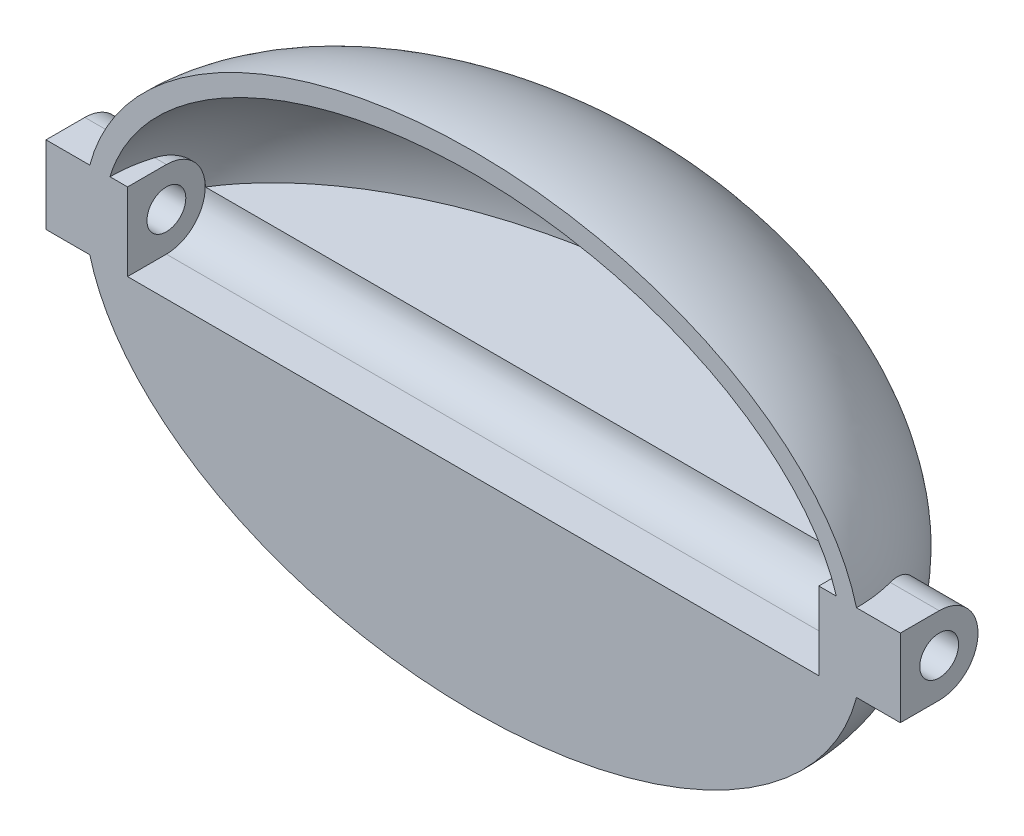
from build123d import *
from build123d.topology import SkipClean

# Parameters (mm, degrees)
SKETCH_3_W          = 40
SKETCH_3_H          = 40
CUT_EXTRUDE_1_DEPTH = 70
CUT_REVOLVE_1_ANGLE = 90
CUT_EXTRUDE_2_DEPTH = 456.68629575
EXTRUDE_1_DEPTH     = 42
SKETCH_7_R          = 10
CUT_EXTRUDE_3_DEPTH = 440


with BuildPart() as part:
    # 草图1 → 旋转3 (revolve)
    with SkipClean():  # the faces are left unmerged after this step: merging them gives an invalid solid
        with BuildSketch(Plane(origin=(0, 0, 0), x_dir=(1, 0, 0), z_dir=(0, 1, 0))):
            with BuildLine():
                add(Edge.make_bspline(
                    [(200, 0), (200, 125), (0, 125), (-200, 125), (-200, 0)],
                    knots=[0, 0, 0, 1.570796327, 1.570796327, 3.141592654, 3.141592654, 3.141592654], degree=2, weights=[1, 0.707106781, 1, 0.707106781, 1]))
                Line((-200, 0), (200, 0))
            make_face()
            with BuildLine():
                Line((200, 0), (-200, 0))
                add(Edge.make_bspline(
                    [(-200, 0), (-200, -125), (0, -125), (200, -125), (200, 0)],
                    knots=[3.141592654, 3.141592654, 3.141592654, 4.71238898, 4.71238898, 6.283185307, 6.283185307, 6.283185307], degree=2, weights=[1, 0.707106781, 1, 0.707106781, 1]))
            make_face()
        revolve(axis=Axis((-376.776806715, 0, 0), (1, 0, 0)))
    add(part.part.scale(1), mode=Mode.REPLACE)  # the faces are merged on a copy

    # Surface Cut 1
    split(bisect_by=Plane.XY, keep=Keep.BOTTOM)

    # 草图3 → 切除-拉伸1 (cut)
    with BuildSketch(Plane(origin=(0, -125.246294878, -45.585923288), x_dir=(1, 0, 0), z_dir=(0, 0.9396926207859081, 0.34202014332566943))):
        with Locations((0, 43.622733675)):
            Rectangle(SKETCH_3_W, SKETCH_3_H)
    extrude(amount=CUT_EXTRUDE_1_DEPTH, mode=Mode.SUBTRACT)

    # 草图4 → 切除-旋转1 (revolve, cut)
    with BuildSketch(Plane.XY):
        with BuildLine():
            Line((-189.264857791, 10), (189.264857791, 10))
            add(Edge.make_bspline(
                [(189.264857791, 10), (189.01661408, 11.685645813), (188.399842232, 15.02459428), (186.660672029, 21.717695752), (183.544014825, 30.028723701), (178.280438028, 39.871100011), (169.238112825, 52.698753606), (154.190025082, 67.938441209), (130.617285564, 84.133702491), (102.331625356, 97.503941795), (70.346299789, 107.469826997), (35.819572857, 113.615740598), (0, 115.692129701), (-35.819572857, 113.615740598), (-70.346299789, 107.469826997), (-102.331625356, 97.503941795), (-130.617285564, 84.133702491), (-154.190025082, 67.938441209), (-169.238112825, 52.698753606), (-178.280438028, 39.871100011), (-183.544014825, 30.028723701), (-186.660672029, 21.717695752), (-188.399842232, 15.02459428), (-189.01661408, 11.685645813), (-189.264857791, 10)],
                knots=[0.091784635, 0.091784635, 0.091784635, 0.091784635, 0.13800375, 0.184222866, 0.276661096, 0.369099327, 0.461537558, 0.646414019, 0.831290481, 1.016166942, 1.201043404, 1.385919865, 1.570796327, 1.755672788, 1.94054925, 2.125425711, 2.310302173, 2.495178634, 2.680055096, 2.772493326, 2.864931557, 2.957369788, 3.003588903, 3.049808019, 3.049808019, 3.049808019, 3.049808019], degree=3))
        make_face()
    revolve(axis=Axis((-200, 0, 0), (-1, 0, 0)), revolution_arc=CUT_REVOLVE_1_ANGLE, mode=Mode.SUBTRACT)

    # 草图5 → 切除-拉伸2 (cut, through all)
    with BuildSketch(Plane(origin=(220, 0, 0), x_dir=(0, 0, -1), z_dir=(1, 0, 0))):
        with BuildLine():
            ThreePointArc((20, 20), (40, 0), (20, -20))
            Line((20, -20), (0, -20))
            Line((0, -20), (0, 20))
            Line((0, 20), (20, 20))
        make_face()
    extrude(amount=-CUT_EXTRUDE_2_DEPTH, mode=Mode.SUBTRACT)

    # 草图6 → 凸台-拉伸1 (add)
    with BuildSketch(Plane(origin=(220, 0, 0), x_dir=(0, 0, -1), z_dir=(1, 0, 0))):
        with BuildLine():
            Line((20, -20), (0, -20))
            Line((0, -20), (0, 20))
            Line((0, 20), (20, 20))
            ThreePointArc((20, 20), (40, 0), (20, -20))
        make_face()
    extrude_1 = extrude(amount=-EXTRUDE_1_DEPTH)

    # 镜向1: 凸台-拉伸1 across plane
    add(extrude_1.mirror(Plane(origin=(0, 0, 0), x_dir=(0, 0, 1), z_dir=(1, 0, 0))))

    # 草图7 → 切除-拉伸3 (cut)
    with BuildSketch(Plane(origin=(220, 0, 0), x_dir=(0, 0, -1), z_dir=(1, 0, 0))):
        with Locations((20, 0)):
            Circle(SKETCH_7_R)
    extrude(amount=-CUT_EXTRUDE_3_DEPTH, mode=Mode.SUBTRACT)


solid = part.part
